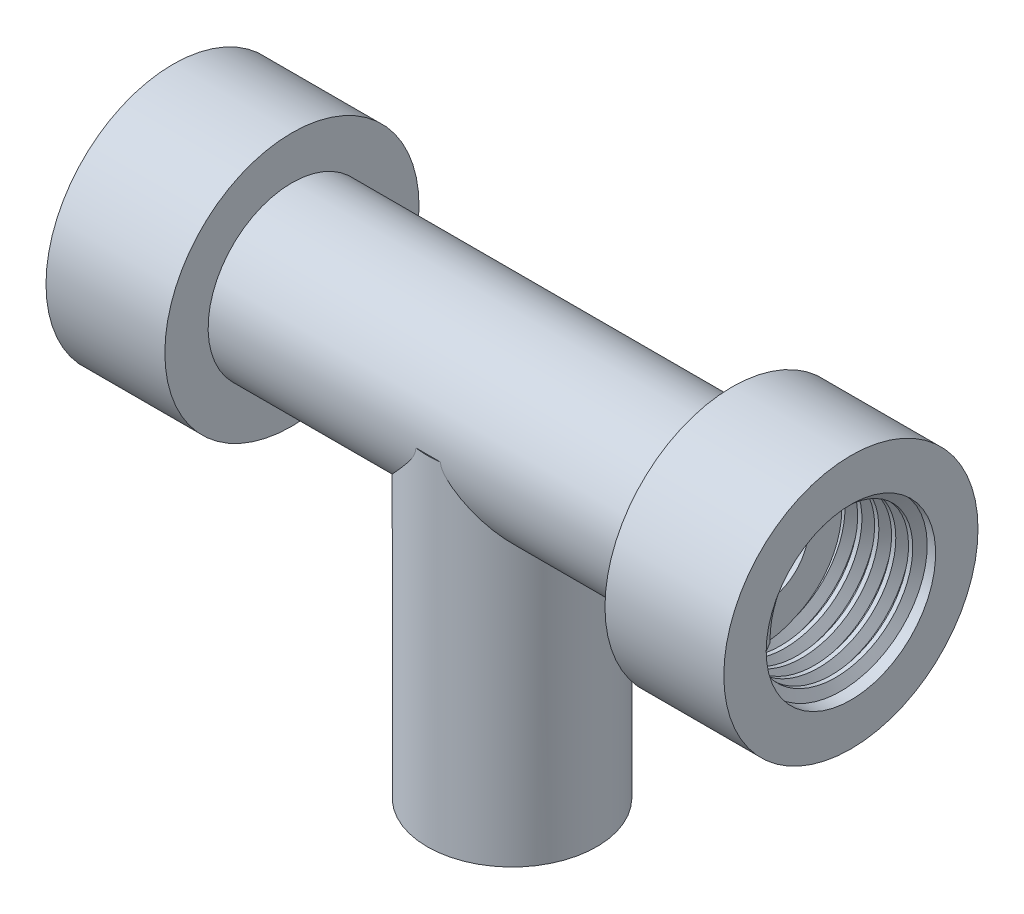
from build123d import *

# Parameters (mm, degrees)
SKETCH4_W          = 6.35
SKETCH4_H          = 25.4
SKETCH6_R          = 3.175
CUT_EXTRUDE1_DEPTH = 25.4
SKETCH7_R          = 3.175
CUT_EXTRUDE2_DEPTH = 38.1
THREAD2_PITCH      = 1.27
THREAD3_PITCH      = 1.27


with BuildPart() as part:
    # Sketch4 → Revolve2 (revolve)
    with BuildSketch(Plane.XY, mode=Mode.PRIVATE) as revolve2_sk:
        with Locations((3.175, -12.7)):
            Rectangle(SKETCH4_W, SKETCH4_H)
    revolve(revolve2_sk.sketch.rotate(Axis((0, 0, 0), (0, -1, 0)), 90), axis=Axis((0, 0, 0), (0, -1, 0)))

    # Sketch5 → Revolve5 (revolve)
    with BuildSketch(Plane.XY, mode=Mode.PRIVATE) as revolve5_sk:
        Polygon((19.05, 0), (0, 0), (0, -6.281717307), (16.492929327, -6.281717307), (16.492929327, -9.525), (25.4, -9.525), (25.4, -6.35), (19.05, -6.35), align=None)
    revolve5 = revolve(revolve5_sk.sketch.rotate(Axis((19.05, 0, 0), (-1, 0, 0)), 180), axis=Axis((19.05, 0, 0), (-1, 0, 0)))

    # Mirror1: Revolve5 across plane
    add(revolve5.mirror(Plane(origin=(0, 0, 0), x_dir=(0, 0, 1), z_dir=(1, 0, 0))))

    # Sketch6 → Cut-Extrude1 (cut)
    with BuildSketch(Plane(origin=(0, -25.4, 0), x_dir=(-1, 0, 0), z_dir=(0, -1, 0))):
        with Locations(Location((0, 0, 0), (0, 0, 90))):
            Circle(SKETCH6_R)
    extrude(amount=-CUT_EXTRUDE1_DEPTH, mode=Mode.SUBTRACT)

    # Sketch7 → Cut-Extrude2 (cut)
    with BuildSketch(Plane.ZY.offset(19.05)):
        with Locations(Location((0, 0, 0), (0, 0, 270))):
            Circle(SKETCH7_R)
    extrude(amount=-CUT_EXTRUDE2_DEPTH, mode=Mode.SUBTRACT)

    # Thread2: the profile of Thread Profile4 profile screwed along a right-hand helix of 5 turns, 8 arcs to a turn; built about Z, then put on its axis
    thread2_z = Axis((0, 0, 0), (0, 0, 1))
    thread2_corners = [(6.3503, 0, -0.000173205), (6.3503, 0, 1.111423202), (5.662592339, 0, 0.714374998), (5.662592339, 0, 0.396874998)]
    with BuildLine(mode=Mode.PRIVATE) as thread2_profile:
        Line(thread2_corners[0], thread2_corners[1])
        Line(thread2_corners[1], thread2_corners[2])
        Line(thread2_corners[2], thread2_corners[3])
        Line(thread2_corners[3], thread2_corners[0])
    thread2_cap = Face(thread2_profile.wire())
    thread2_turn_angles = [0, 22.5, 45, 67.5, 90, 112.5, 135, 157.5, 180, 202.5, 225, 247.5, 270, 292.5, 315, 337.5, 360]
    thread2_turn_weights = [1, 0.9238795325112867, 1, 0.9238795325112867, 1, 0.9238795325112867, 1, 0.9238795325112867, 1, 0.9238795325112867, 1, 0.9238795325112867, 1, 0.9238795325112867, 1, 0.9238795325112867, 1]
    thread2_turn_rails = [Edge.make_bspline([Vector(p[0], p[1], 0).rotate(thread2_z, thread2_turn_angles[k]) / thread2_turn_weights[k] + Vector(0, 0, p[2] + THREAD2_PITCH * thread2_turn_angles[k] / 360) for k in range(17)], [0, 0, 0, 1, 1, 2, 2, 3, 3, 4, 4, 5, 5, 6, 6, 7, 7, 8, 8, 8], 2, thread2_turn_weights) for p in thread2_corners]
    thread2_turn_sides = [Face.make_surface_from_curves(thread2_turn_rails[p[0]], thread2_turn_rails[p[1]]) for p in [(0, 1), (1, 2), (2, 3), (3, 0)]]
    thread2 = Plane(origin=(25.4, 0, 0), x_dir=(0, 0, 1), z_dir=(-1, 0, 0)) * Solid(Shell([*[p.moved(Location((0, 0, THREAD2_PITCH * i))) for i in range(5) for p in thread2_turn_sides], thread2_cap, thread2_cap.rotate(thread2_z, 1800).moved(Location((0, 0, THREAD2_PITCH * 1800 / 360)))]))
    add(thread2)

    # Thread3: the profile of Thread Profile5 profile screwed along a right-hand helix of 5 turns, 8 arcs to a turn; built about Z, then put on its axis
    thread3_z = Axis((0, 0, 0), (0, 0, 1))
    thread3_corners = [(6.3503, 0, -0.000173205), (6.3503, 0, 1.111423202), (5.662592339, 0, 0.714374998), (5.662592339, 0, 0.396874998)]
    with BuildLine(mode=Mode.PRIVATE) as thread3_profile:
        Line(thread3_corners[0], thread3_corners[1])
        Line(thread3_corners[1], thread3_corners[2])
        Line(thread3_corners[2], thread3_corners[3])
        Line(thread3_corners[3], thread3_corners[0])
    thread3_cap = Face(thread3_profile.wire())
    thread3_turn_angles = [0, 22.5, 45, 67.5, 90, 112.5, 135, 157.5, 180, 202.5, 225, 247.5, 270, 292.5, 315, 337.5, 360]
    thread3_turn_weights = [1, 0.9238795325112867, 1, 0.9238795325112867, 1, 0.9238795325112867, 1, 0.9238795325112867, 1, 0.9238795325112867, 1, 0.9238795325112867, 1, 0.9238795325112867, 1, 0.9238795325112867, 1]
    thread3_turn_rails = [Edge.make_bspline([Vector(p[0], p[1], 0).rotate(thread3_z, thread3_turn_angles[k]) / thread3_turn_weights[k] + Vector(0, 0, p[2] + THREAD3_PITCH * thread3_turn_angles[k] / 360) for k in range(17)], [0, 0, 0, 1, 1, 2, 2, 3, 3, 4, 4, 5, 5, 6, 6, 7, 7, 8, 8, 8], 2, thread3_turn_weights) for p in thread3_corners]
    thread3_turn_sides = [Face.make_surface_from_curves(thread3_turn_rails[p[0]], thread3_turn_rails[p[1]]) for p in [(0, 1), (1, 2), (2, 3), (3, 0)]]
    thread3 = Plane(origin=(-19.05, 0, 0), x_dir=(0, 0, 1), z_dir=(-1, 0, 0)) * Solid(Shell([*[p.moved(Location((0, 0, THREAD3_PITCH * i))) for i in range(5) for p in thread3_turn_sides], thread3_cap, thread3_cap.rotate(thread3_z, 1800).moved(Location((0, 0, THREAD3_PITCH * 1800 / 360)))]))
    add(thread3)


solid = part.part
